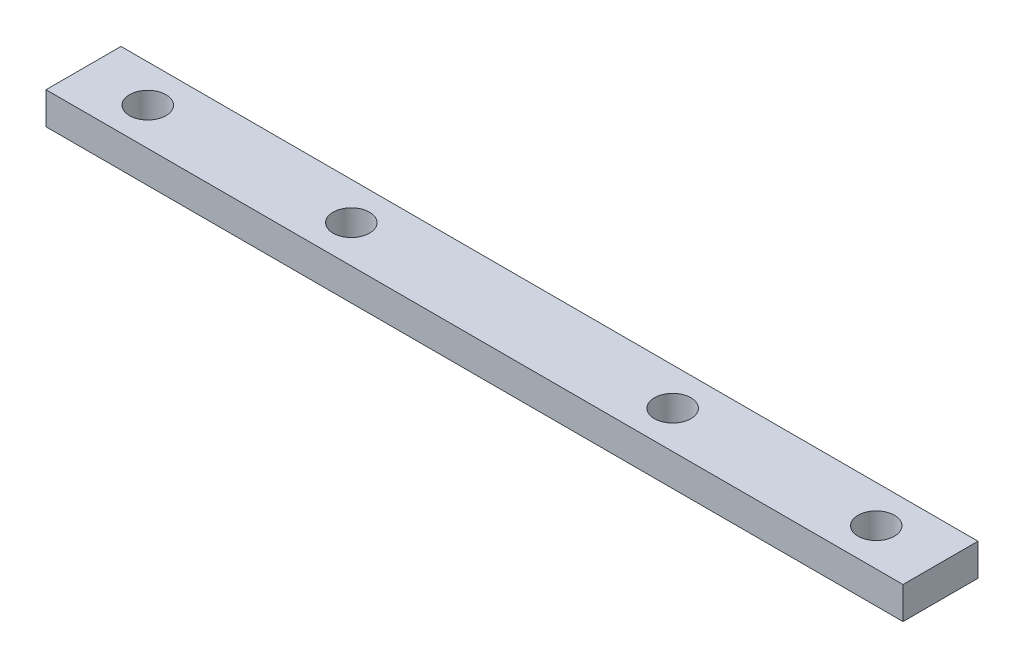
from build123d import *

# Parameters (mm, degrees)
SKETCH1_W           = 80
SKETCH1_H           = 7
BOSS_EXTRUDE1_DEPTH = 3
SKETCH2_R           = 1.7
CUT_EXTRUDE1_DEPTH  = 41.264748851


with BuildPart() as part:
    # Sketch1 → Boss-Extrude1 (new body)
    with BuildSketch(Plane(origin=(0, 0, 0), x_dir=(1, 0, 0), z_dir=(0, 1, 0))):
        Rectangle(SKETCH1_W, SKETCH1_H)
    extrude(amount=BOSS_EXTRUDE1_DEPTH)

    # Sketch2 → Cut-Extrude1 (cut, through all)
    with BuildSketch(Plane(origin=(0, 3, 0), x_dir=(1, 0, 0), z_dir=(0, 1, 0))):
        with Locations((-34, 0)):
            Circle(SKETCH2_R)
        with Locations((-15, 0)):
            Circle(SKETCH2_R)
        with Locations((15, 0)):
            Circle(SKETCH2_R)
        with Locations((34, 0)):
            Circle(SKETCH2_R)
    extrude(amount=-CUT_EXTRUDE1_DEPTH, mode=Mode.SUBTRACT)


solid = part.part
